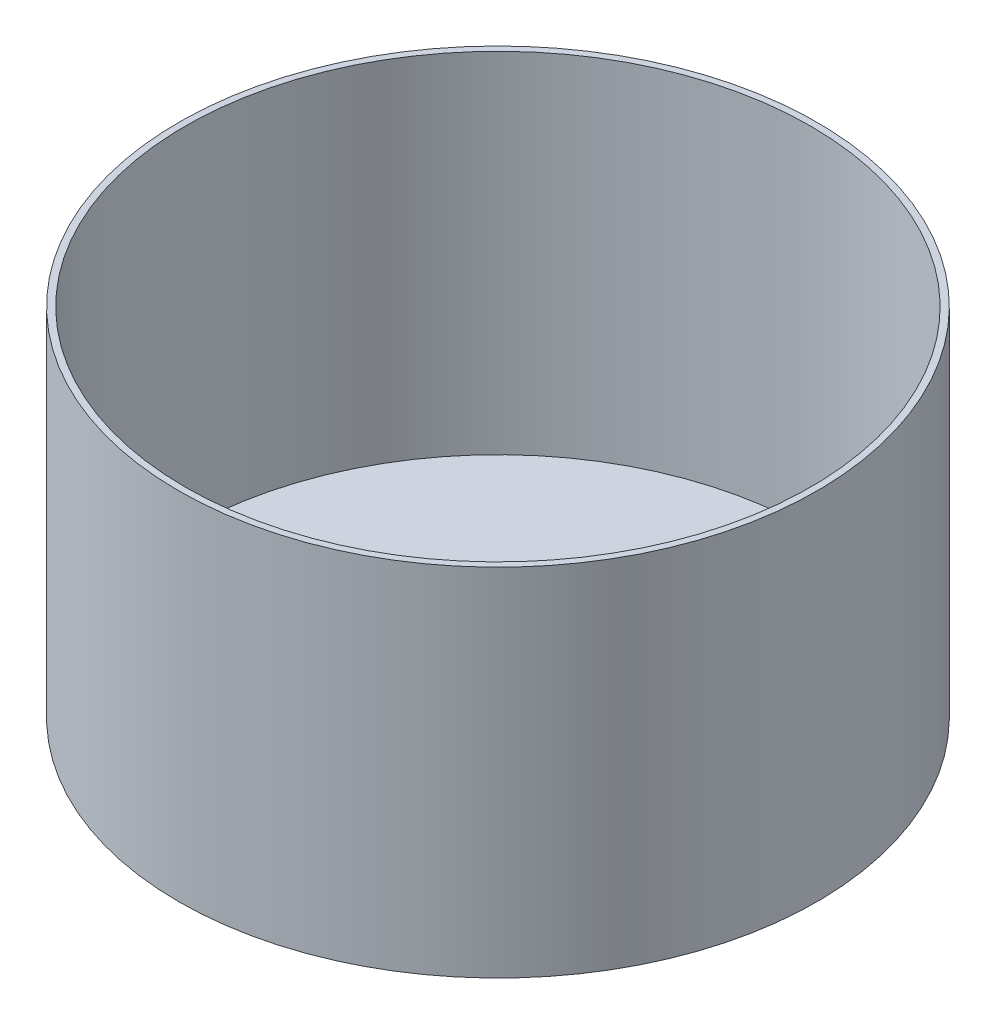
from build123d import *

# Parameters (mm, degrees)
BASKET_BASE_RING_SKETCH_R   = 148
BASKET_BASE_RING_SKETCH_R_2 = 65
BASKET_BASE_RING_DEPTH      = 3
BASKET_WALL_SKETCH_R        = 148
BASKET_WALL_SKETCH_R_2      = 145
BASKET_WALL_DEPTH           = 165


with BuildPart() as part:
    # Basket Base Ring Sketch → Basket Base Ring (new body)
    with BuildSketch(Plane(origin=(0, 0, 0), x_dir=(1, 0, 0), z_dir=(0, 1, 0))):
        Circle(BASKET_BASE_RING_SKETCH_R)
        Circle(BASKET_BASE_RING_SKETCH_R_2, mode=Mode.SUBTRACT)
    extrude(amount=BASKET_BASE_RING_DEPTH)

    # Basket Wall Sketch → Basket Wall (add)
    with BuildSketch(Plane(origin=(0, 0, 0), x_dir=(1, 0, 0), z_dir=(0, 1, 0))):
        Circle(BASKET_WALL_SKETCH_R)
        Circle(BASKET_WALL_SKETCH_R_2, mode=Mode.SUBTRACT)
    extrude(amount=BASKET_WALL_DEPTH)


solid = part.part
